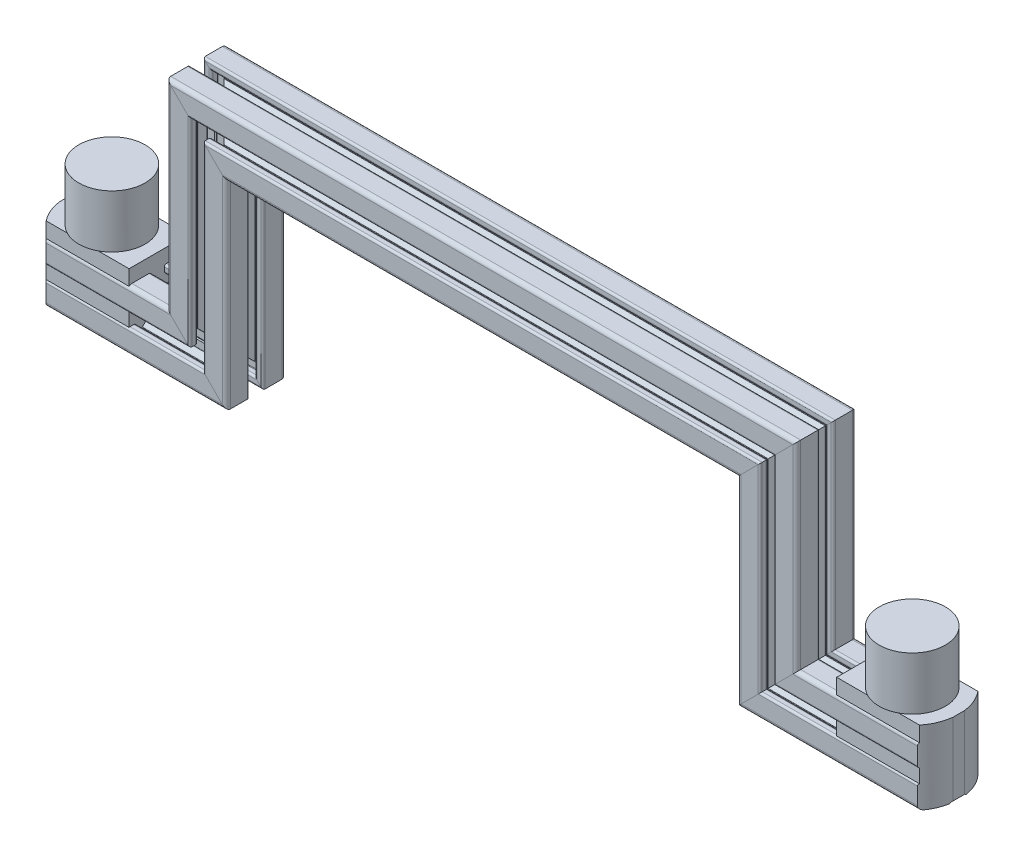
from build123d import *

# Parameters (mm, degrees)
SKETCH6_W            = 44.121320344
SKETCH6_H            = 54.791290411
BOSS_EXTRUDE3_DEPTH  = 70
SKETCH4_R            = 25
FL_WHEEL_MOUNT_DEPTH = 40
CUT_EXTRUDE1_DEPTH   = 366.853624348


with BuildPart() as part:
    # Sweep1: sweep along a path in Sketch1
    with BuildLine(Plane.XY) as sweep1_path:
        Line((0, 0), (125, 0))
        Line((125, 0), (125, 150))
        Line((125, 150), (337, 150))
    # Sketch7 → Sweep1 (sweep)
    with BuildSketch(Plane(origin=(0, 0, 0), x_dir=(0, 0, -1), z_dir=(1, 0, 0))):
        with BuildLine():
            Line((4.905816029, 11.21531926), (4.005816103, 10.700171216))
            Line((4.005816103, 10.700171216), (3.105816176, 11.21531926))
            Line((3.105816176, 11.21531926), (-2.197508215, 11.21531926))
            ThreePointArc((-2.197508215, 11.21531926), (-2.342927919, 11.244245037), (-2.466208792, 11.326618683))
            Line((-2.466208792, 11.326618683), (-5.932884474, 14.793294365))
            ThreePointArc((-5.932884474, 14.793294365), (-6.01525812, 14.916575238), (-6.044183897, 15.061994942))
            Line((-6.044183897, 15.061994942), (-6.044183897, 19.35531926))
            ThreePointArc((-6.044183897, 19.35531926), (-5.932884474, 19.624019836), (-5.664183897, 19.73531926))
            Line((-5.664183897, 19.73531926), (-2.579183897, 19.73531926))
            ThreePointArc((-2.579183897, 19.73531926), (-1.50438159, 20.180516952), (-1.059183897, 21.25531926))
            Line((-1.059183897, 21.25531926), (-1.059183897, 24.21531926))
            ThreePointArc((-1.059183897, 24.21531926), (-1.50438159, 25.290121567), (-2.579183897, 25.73531926))
            Line((-2.579183897, 25.73531926), (-15.494183897, 25.73531926))
            ThreePointArc((-15.494183897, 25.73531926), (-17.615504241, 24.856639603), (-18.494183897, 22.73531926))
            Line((-18.494183897, 22.73531926), (-18.494183897, 9.82031926))
            ThreePointArc((-18.494183897, 9.82031926), (-18.048986205, 8.745516952), (-16.974183897, 8.30031926))
            Line((-16.974183897, 8.30031926), (-14.014183897, 8.30031926))
            ThreePointArc((-14.014183897, 8.30031926), (-12.93938159, 8.745516952), (-12.494183897, 9.82031926))
            Line((-12.494183897, 9.82031926), (-12.494183897, 12.90531926))
            ThreePointArc((-12.494183897, 12.90531926), (-12.382884474, 13.174019836), (-12.114183897, 13.28531926))
            Line((-12.114183897, 13.28531926), (-7.813788512, 13.28531926))
            ThreePointArc((-7.813788512, 13.28531926), (-7.668368808, 13.256393482), (-7.545087935, 13.174019836))
            Line((-7.545087935, 13.174019836), (-4.08548332, 9.714415222))
            ThreePointArc((-4.08548332, 9.714415222), (-4.003109675, 9.591134349), (-3.974183897, 9.445714645))
            Line((-3.974183897, 9.445714645), (-3.974183897, 4.135318895))
            Line((-3.974183897, 4.135318895), (-3.454570628, 3.23531926))
            Line((-3.454570628, 3.23531926), (-3.974183897, 2.335319624))
            Line((-3.974183897, 2.335319624), (-3.974183897, -2.968005058))
            ThreePointArc((-3.974183897, -2.968005058), (-4.003109675, -3.113424762), (-4.08548332, -3.236705635))
            Line((-4.08548332, -3.236705635), (-7.552159003, -6.703381317))
            ThreePointArc((-7.552159003, -6.703381317), (-7.675439876, -6.785754963), (-7.82085958, -6.81468074))
            Line((-7.82085958, -6.81468074), (-12.114183897, -6.81468074))
            ThreePointArc((-12.114183897, -6.81468074), (-12.382884474, -6.703381317), (-12.494183897, -6.43468074))
            Line((-12.494183897, -6.43468074), (-12.494183897, -3.34968074))
            ThreePointArc((-12.494183897, -3.34968074), (-12.93938159, -2.274878433), (-14.014183897, -1.82968074))
            Line((-14.014183897, -1.82968074), (-16.974183897, -1.82968074))
            ThreePointArc((-16.974183897, -1.82968074), (-18.048986205, -2.274878433), (-18.494183897, -3.34968074))
            Line((-18.494183897, -3.34968074), (-18.494183897, -16.26468074))
            ThreePointArc((-18.494183897, -16.26468074), (-17.615504241, -18.386001084), (-15.494183897, -19.26468074))
            Line((-15.494183897, -19.26468074), (-2.579183897, -19.26468074))
            ThreePointArc((-2.579183897, -19.26468074), (-1.50438159, -18.819483048), (-1.059183897, -17.74468074))
            Line((-1.059183897, -17.74468074), (-1.059183897, -14.78468074))
            ThreePointArc((-1.059183897, -14.78468074), (-1.50438159, -13.709878433), (-2.579183897, -13.26468074))
            Line((-2.579183897, -13.26468074), (-5.664183897, -13.26468074))
            ThreePointArc((-5.664183897, -13.26468074), (-5.932884474, -13.153381317), (-6.044183897, -12.88468074))
            Line((-6.044183897, -12.88468074), (-6.044183897, -8.584285355))
            ThreePointArc((-6.044183897, -8.584285355), (-6.01525812, -8.438865651), (-5.932884474, -8.315584778))
            Line((-5.932884474, -8.315584778), (-2.473279859, -4.855980164))
            ThreePointArc((-2.473279859, -4.855980164), (-2.349998987, -4.773606518), (-2.204579283, -4.74468074))
            Line((-2.204579283, -4.74468074), (3.105816176, -4.74468074))
            Line((3.105816176, -4.74468074), (4.005816103, -4.229532697))
            Line((4.005816103, -4.229532697), (4.905816029, -4.74468074))
            Line((4.905816029, -4.74468074), (10.20914042, -4.74468074))
            ThreePointArc((10.20914042, -4.74468074), (10.354560124, -4.773606518), (10.477840997, -4.855980164))
            Line((10.477840997, -4.855980164), (13.94451668, -8.322655846))
            ThreePointArc((13.94451668, -8.322655846), (14.026890325, -8.445936719), (14.055816103, -8.591356423))
            Line((14.055816103, -8.591356423), (14.055816103, -12.88468074))
            ThreePointArc((14.055816103, -12.88468074), (13.94451668, -13.153381317), (13.675816103, -13.26468074))
            Line((13.675816103, -13.26468074), (10.590816103, -13.26468074))
            ThreePointArc((10.590816103, -13.26468074), (9.516013795, -13.709878433), (9.070816103, -14.78468074))
            Line((9.070816103, -14.78468074), (9.070816103, -17.74468074))
            ThreePointArc((9.070816103, -17.74468074), (9.516013795, -18.819483048), (10.590816103, -19.26468074))
            Line((10.590816103, -19.26468074), (23.505816103, -19.26468074))
            ThreePointArc((23.505816103, -19.26468074), (25.627136446, -18.386001084), (26.505816103, -16.26468074))
            Line((26.505816103, -16.26468074), (26.505816103, -3.34968074))
            ThreePointArc((26.505816103, -3.34968074), (26.06061841, -2.274878433), (24.985816103, -1.82968074))
            Line((24.985816103, -1.82968074), (22.025816103, -1.82968074))
            ThreePointArc((22.025816103, -1.82968074), (20.951013795, -2.274878433), (20.505816103, -3.34968074))
            Line((20.505816103, -3.34968074), (20.505816103, -6.43468074))
            ThreePointArc((20.505816103, -6.43468074), (20.39451668, -6.703381317), (20.125816103, -6.81468074))
            Line((20.125816103, -6.81468074), (15.825420717, -6.81468074))
            ThreePointArc((15.825420717, -6.81468074), (15.680001013, -6.785754963), (15.556720141, -6.703381317))
            Line((15.556720141, -6.703381317), (12.097115526, -3.243776702))
            ThreePointArc((12.097115526, -3.243776702), (12.01474188, -3.12049583), (11.985816103, -2.975076126))
            Line((11.985816103, -2.975076126), (11.985816103, 2.335319624))
            Line((11.985816103, 2.335319624), (11.466202833, 3.23531926))
            Line((11.466202833, 3.23531926), (11.985816103, 4.135318895))
            Line((11.985816103, 4.135318895), (11.985816103, 9.438643577))
            ThreePointArc((11.985816103, 9.438643577), (12.01474188, 9.584063281), (12.097115526, 9.707344154))
            Line((12.097115526, 9.707344154), (15.563791208, 13.174019836))
            ThreePointArc((15.563791208, 13.174019836), (15.687072081, 13.256393482), (15.832491785, 13.28531926))
            Line((15.832491785, 13.28531926), (20.125816103, 13.28531926))
            ThreePointArc((20.125816103, 13.28531926), (20.39451668, 13.174019836), (20.505816103, 12.90531926))
            Line((20.505816103, 12.90531926), (20.505816103, 9.82031926))
            ThreePointArc((20.505816103, 9.82031926), (20.951013795, 8.745516952), (22.025816103, 8.30031926))
            Line((22.025816103, 8.30031926), (24.985816103, 8.30031926))
            ThreePointArc((24.985816103, 8.30031926), (26.06061841, 8.745516952), (26.505816103, 9.82031926))
            Line((26.505816103, 9.82031926), (26.505816103, 22.73531926))
            ThreePointArc((26.505816103, 22.73531926), (25.627136446, 24.856639603), (23.505816103, 25.73531926))
            Line((23.505816103, 25.73531926), (10.590816103, 25.73531926))
            ThreePointArc((10.590816103, 25.73531926), (9.516013795, 25.290121567), (9.070816103, 24.21531926))
            Line((9.070816103, 24.21531926), (9.070816103, 21.25531926))
            ThreePointArc((9.070816103, 21.25531926), (9.516013795, 20.180516952), (10.590816103, 19.73531926))
            Line((10.590816103, 19.73531926), (13.675816103, 19.73531926))
            ThreePointArc((13.675816103, 19.73531926), (13.94451668, 19.624019836), (14.055816103, 19.35531926))
            Line((14.055816103, 19.35531926), (14.055816103, 15.054923874))
            ThreePointArc((14.055816103, 15.054923874), (14.026890325, 14.90950417), (13.94451668, 14.786223298))
            Line((13.94451668, 14.786223298), (10.484912065, 11.326618683))
            ThreePointArc((10.484912065, 11.326618683), (10.361631192, 11.244245037), (10.216211488, 11.21531926))
            Line((10.216211488, 11.21531926), (4.905816029, 11.21531926))
        make_face()
        with BuildLine():
            Line((13.969837884, 21.274341041), (13.529837884, 21.274341041))
            ThreePointArc((13.529837884, 21.274341041), (12.469177713, 21.713680869), (12.029837884, 22.774341041))
            Line((12.029837884, 22.774341041), (12.029837884, 23.274341041))
            ThreePointArc((12.029837884, 23.274341041), (12.469177713, 24.335001213), (13.529837884, 24.774341041))
            Line((13.529837884, 24.774341041), (23.139837884, 24.774341041))
            ThreePointArc((23.139837884, 24.774341041), (24.752041345, 24.106544502), (25.419837884, 22.494341041))
            Line((25.419837884, 22.494341041), (25.419837884, 12.884341041))
            ThreePointArc((25.419837884, 12.884341041), (24.980498056, 11.823680869), (23.919837884, 11.384341041))
            Line((23.919837884, 11.384341041), (23.419837884, 11.384341041))
            ThreePointArc((23.419837884, 11.384341041), (22.359177713, 11.823680869), (21.919837884, 12.884341041))
            Line((21.919837884, 12.884341041), (21.919837884, 13.324341041))
            ThreePointArc((21.919837884, 13.324341041), (21.626944666, 14.031447822), (20.919837884, 14.324341041))
            Line((20.919837884, 14.324341041), (15.349837884, 14.324341041))
            ThreePointArc((15.349837884, 14.324341041), (15.081137307, 14.435640464), (14.969837884, 14.704341041))
            Line((14.969837884, 14.704341041), (14.969837884, 20.274341041))
            ThreePointArc((14.969837884, 20.274341041), (14.676944666, 20.981447822), (13.969837884, 21.274341041))
        make_face(mode=Mode.SUBTRACT)
        with BuildLine():
            Line((21.958859666, -6.68968074), (21.958859666, -6.24968074))
            ThreePointArc((21.958859666, -6.24968074), (22.398199494, -5.189020569), (23.458859666, -4.74968074))
            Line((23.458859666, -4.74968074), (23.958859666, -4.74968074))
            ThreePointArc((23.958859666, -4.74968074), (25.019519838, -5.189020569), (25.458859666, -6.24968074))
            Line((25.458859666, -6.24968074), (25.458859666, -15.85968074))
            ThreePointArc((25.458859666, -15.85968074), (24.791063127, -17.471884201), (23.178859666, -18.13968074))
            Line((23.178859666, -18.13968074), (13.568859666, -18.13968074))
            ThreePointArc((13.568859666, -18.13968074), (12.508199494, -17.700340912), (12.068859666, -16.63968074))
            Line((12.068859666, -16.63968074), (12.068859666, -16.13968074))
            ThreePointArc((12.068859666, -16.13968074), (12.508199494, -15.079020569), (13.568859666, -14.63968074))
            Line((13.568859666, -14.63968074), (14.008859666, -14.63968074))
            ThreePointArc((14.008859666, -14.63968074), (14.715966447, -14.346787522), (15.008859666, -13.63968074))
            Line((15.008859666, -13.63968074), (15.008859666, -8.06968074))
            ThreePointArc((15.008859666, -8.06968074), (15.120159089, -7.800980164), (15.388859666, -7.68968074))
            Line((15.388859666, -7.68968074), (20.958859666, -7.68968074))
            ThreePointArc((20.958859666, -7.68968074), (21.665966447, -7.396787522), (21.958859666, -6.68968074))
        make_face(mode=Mode.SUBTRACT)
        with BuildLine():
            Line((-6.005162116, -14.678702522), (-5.565162116, -14.678702522))
            ThreePointArc((-5.565162116, -14.678702522), (-4.504501944, -15.11804235), (-4.065162116, -16.178702522))
            Line((-4.065162116, -16.178702522), (-4.065162116, -16.678702522))
            ThreePointArc((-4.065162116, -16.678702522), (-4.504501944, -17.739362694), (-5.565162116, -18.178702522))
            Line((-5.565162116, -18.178702522), (-15.175162116, -18.178702522))
            ThreePointArc((-15.175162116, -18.178702522), (-16.787365577, -17.510905983), (-17.455162116, -15.898702522))
            Line((-17.455162116, -15.898702522), (-17.455162116, -6.288702522))
            ThreePointArc((-17.455162116, -6.288702522), (-17.015822287, -5.22804235), (-15.955162116, -4.788702522))
            Line((-15.955162116, -4.788702522), (-15.455162116, -4.788702522))
            ThreePointArc((-15.455162116, -4.788702522), (-14.394501944, -5.22804235), (-13.955162116, -6.288702522))
            Line((-13.955162116, -6.288702522), (-13.955162116, -6.728702522))
            ThreePointArc((-13.955162116, -6.728702522), (-13.662268897, -7.435809303), (-12.955162116, -7.728702522))
            Line((-12.955162116, -7.728702522), (-7.385162116, -7.728702522))
            ThreePointArc((-7.385162116, -7.728702522), (-7.116461539, -7.840001945), (-7.005162116, -8.108702522))
            Line((-7.005162116, -8.108702522), (-7.005162116, -13.678702522))
            ThreePointArc((-7.005162116, -13.678702522), (-6.712268897, -14.385809303), (-6.005162116, -14.678702522))
        make_face(mode=Mode.SUBTRACT)
        with BuildLine():
            Line((1.828915922, -2.488564034), (1.413170132, -2.316356489))
            ThreePointArc((1.413170132, -2.316356489), (0.823336155, -1.625307126), (1.036269925, -0.742067321))
            ThreePointArc((1.036269925, -0.742067321), (0.446703204, -0.237613869), (-0.057716637, 0.351981608))
            ThreePointArc((-0.057716637, 0.351981608), (-0.940937171, 0.139101897), (-1.631952253, 0.728927667))
            Line((-1.631952253, 0.728927667), (-1.804159798, 1.144673456))
            ThreePointArc((-1.804159798, 1.144673456), (-1.732589712, 2.050394753), (-0.957477943, 2.524372695))
            ThreePointArc((-0.957477943, 2.524372695), (-1.017662114, 3.297961778), (-0.957433843, 4.071547428))
            ThreePointArc((-0.957433843, 4.071547428), (-1.73249376, 4.54554997), (-1.804045409, 5.451241222))
            Line((-1.804045409, 5.451241222), (-1.631837865, 5.866987012))
            ThreePointArc((-1.631837865, 5.866987012), (-0.940788501, 6.456820989), (-0.057548696, 6.243887219))
            ThreePointArc((-0.057548696, 6.243887219), (0.446904755, 6.83345394), (1.036500233, 7.33787378))
            ThreePointArc((1.036500233, 7.33787378), (0.823620522, 8.221094315), (1.413446291, 8.912109397))
            Line((1.413446291, 8.912109397), (1.829192081, 9.084316942))
            ThreePointArc((1.829192081, 9.084316942), (2.734913377, 9.012746856), (3.20889132, 8.237635087))
            ThreePointArc((3.20889132, 8.237635087), (3.982480402, 8.297819258), (4.756066053, 8.237590987))
            ThreePointArc((4.756066053, 8.237590987), (5.230068594, 9.012650904), (6.135759847, 9.084202553))
            Line((6.135759847, 9.084202553), (6.551505636, 8.911995008))
            ThreePointArc((6.551505636, 8.911995008), (7.141339614, 8.220945645), (6.928405843, 7.33770584))
            ThreePointArc((6.928405843, 7.33770584), (7.517972564, 6.833252389), (8.022392405, 6.243656911))
            ThreePointArc((8.022392405, 6.243656911), (8.905612939, 6.456536622), (9.596628022, 5.866710852))
            Line((9.596628022, 5.866710852), (9.768835567, 5.450965063))
            ThreePointArc((9.768835567, 5.450965063), (9.697265481, 4.545243766), (8.922153712, 4.071265824))
            ThreePointArc((8.922153712, 4.071265824), (8.982337882, 3.297676741), (8.922109612, 2.524091091))
            ThreePointArc((8.922109612, 2.524091091), (9.697169528, 2.05008855), (9.768721178, 1.144397297))
            Line((9.768721178, 1.144397297), (9.596513633, 0.728651507))
            ThreePointArc((9.596513633, 0.728651507), (8.90546427, 0.13881753), (8.022224464, 0.351751301))
            ThreePointArc((8.022224464, 0.351751301), (7.517771013, -0.23781542), (6.928175536, -0.742235261))
            ThreePointArc((6.928175536, -0.742235261), (7.141055247, -1.625455795), (6.551229477, -2.316470878))
            Line((6.551229477, -2.316470878), (6.135483688, -2.488678423))
            ThreePointArc((6.135483688, -2.488678423), (5.229762391, -2.417108337), (4.755784449, -1.641996568))
            ThreePointArc((4.755784449, -1.641996568), (3.982195366, -1.702180738), (3.208609716, -1.641952468))
            ThreePointArc((3.208609716, -1.641952468), (2.734607174, -2.417012384), (1.828915922, -2.488564034))
        make_face(mode=Mode.SUBTRACT)
        with BuildLine():
            Line((-13.994183897, 13.28531926), (-13.994183897, 12.84531926))
            ThreePointArc((-13.994183897, 12.84531926), (-14.433523726, 11.784659088), (-15.494183897, 11.34531926))
            Line((-15.494183897, 11.34531926), (-15.994183897, 11.34531926))
            ThreePointArc((-15.994183897, 11.34531926), (-17.054844069, 11.784659088), (-17.494183897, 12.84531926))
            Line((-17.494183897, 12.84531926), (-17.494183897, 22.45531926))
            ThreePointArc((-17.494183897, 22.45531926), (-16.826387358, 24.067522721), (-15.214183897, 24.73531926))
            Line((-15.214183897, 24.73531926), (-5.604183897, 24.73531926))
            ThreePointArc((-5.604183897, 24.73531926), (-4.543523726, 24.295979431), (-4.104183897, 23.23531926))
            Line((-4.104183897, 23.23531926), (-4.104183897, 22.73531926))
            ThreePointArc((-4.104183897, 22.73531926), (-4.543523726, 21.674659088), (-5.604183897, 21.23531926))
            Line((-5.604183897, 21.23531926), (-6.044183897, 21.23531926))
            ThreePointArc((-6.044183897, 21.23531926), (-6.751290679, 20.942426041), (-7.044183897, 20.23531926))
            Line((-7.044183897, 20.23531926), (-7.044183897, 14.66531926))
            ThreePointArc((-7.044183897, 14.66531926), (-7.15548332, 14.396618683), (-7.424183897, 14.28531926))
            Line((-7.424183897, 14.28531926), (-12.994183897, 14.28531926))
            ThreePointArc((-12.994183897, 14.28531926), (-13.701290679, 13.992426041), (-13.994183897, 13.28531926))
        make_face(mode=Mode.SUBTRACT)
    sweep1 = sweep(path=sweep1_path.line, transition=Transition.RIGHT)

    # Sketch6 → Boss-Extrude3 (add)
    with BuildSketch(Plane.ZY):
        with Locations((-4.445155931, 9.009644122)):
            Rectangle(SKETCH6_W, SKETCH6_H)
    boss_extrude3 = extrude(amount=-BOSS_EXTRUDE3_DEPTH)

    # Sketch4 → FL Wheel Mount (add)
    with BuildSketch(Plane(origin=(0, 36.405289327, 0), x_dir=(1, 0, 0), z_dir=(0, 1, 0))):
        with Locations((35, 4.445155931)):
            Circle(SKETCH4_R)
    fl_wheel_mount = extrude(amount=FL_WHEEL_MOUNT_DEPTH)

    # Sketch5 → Cut-Extrude1 (cut, through all)
    with BuildSketch(Plane(origin=(0, 36.405289327, 0), x_dir=(1, 0, 0), z_dir=(0, 1, 0))):
        with BuildLine():
            Line((35, -30.835992169), (35, -74.811013715))
            Line((35, -74.811013715), (-61.224063347, -74.811013715))
            Line((-61.224063347, -74.811013715), (-61.224063347, 58.492105505))
            Line((-61.224063347, 58.492105505), (35, 58.492105505))
            Line((35, 58.492105505), (35, 39.726304031))
            ThreePointArc((35, 39.726304031), (-0.2811481, 4.445155931), (35, -30.835992169))
        make_face()
    cut_extrude1 = extrude(amount=-CUT_EXTRUDE1_DEPTH, mode=Mode.SUBTRACT)

    # Mirror1: Sweep1, Boss-Extrude3, FL Wheel Mount, Cut-Extrude1 across plane
    add(sweep1.mirror(Plane(origin=(337, 0, 0), x_dir=(0, 0, 1), z_dir=(1, 0, 0))))
    add(boss_extrude3.mirror(Plane(origin=(337, 0, 0), x_dir=(0, 0, 1), z_dir=(1, 0, 0))))
    add(fl_wheel_mount.mirror(Plane(origin=(337, 0, 0), x_dir=(0, 0, 1), z_dir=(1, 0, 0))))
    add(cut_extrude1.mirror(Plane(origin=(337, 0, 0), x_dir=(0, 0, 1), z_dir=(1, 0, 0))), mode=Mode.SUBTRACT)


solid = part.part
